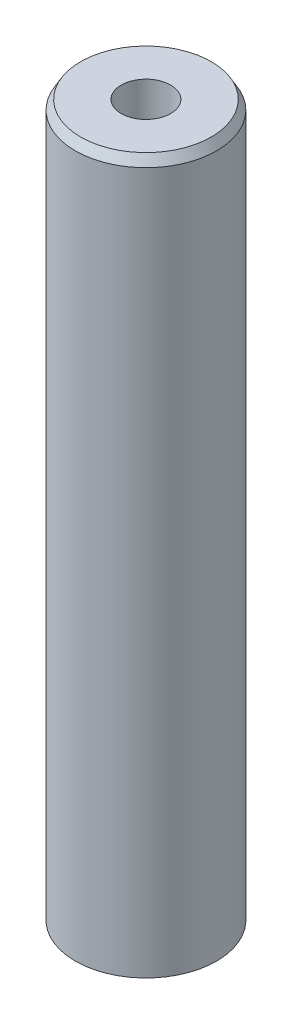
from build123d import *
from OCP.BRepFilletAPI import BRepFilletAPI_MakeChamfer

# Parameters (mm, degrees)
SKETCH1_R           = 27.5
BOSS_EXTRUDE1_DEPTH = 278.762209575
SKETCH2_R           = 9.622641247
CUT_EXTRUDE1_DEPTH  = 282.462021394
CHAMFER1_SIZE       = 3.614289991
CHAMFER1_SIZE2      = 2.086711299


with BuildPart() as part:
    # Sketch1 → Boss-Extrude1 (new body)
    with BuildSketch(Plane(origin=(0, 0, 0), x_dir=(1, 0, 0), z_dir=(0, 1, 0))):
        Circle(SKETCH1_R)
    extrude(amount=BOSS_EXTRUDE1_DEPTH)

    # Sketch2 → Cut-Extrude1 (cut, through all)
    with BuildSketch(Plane(origin=(0, 0, 0), x_dir=(1, 0, 0), z_dir=(0, 1, 0))):
        Circle(SKETCH2_R)
    extrude(amount=CUT_EXTRUDE1_DEPTH, mode=Mode.SUBTRACT)

    # Chamfer1: one chamfer whose edges measure the first distance from different faces: ONE call of the kernel's chamfer builder (chamfer() names one face for all edges)
    chamfer1_edges_1 = [part.edges().sort_by_distance(p)[0] for p in [
        (-27.5, 278.762209575, 0),
    ]]
    chamfer1_side_1 = [part.faces().sort_by_distance(p)[0] for p in [
        (-27.5, 139.381104788, 0),
    ]]
    chamfer1_edges_2 = [part.edges().sort_by_distance(p)[0] for p in [
        (-27.5, 0, 0),
    ]]
    chamfer1_side_2 = [part.faces().sort_by_distance(p)[0] for p in [
        (-26.722182541, 0, 0),
    ]]
    chamfer1 = BRepFilletAPI_MakeChamfer(part.part.solid().wrapped)
    for e in chamfer1_edges_1:
        chamfer1.Add(CHAMFER1_SIZE, CHAMFER1_SIZE2, e.wrapped, chamfer1_side_1[0].wrapped)  # the first distance lies on this face
    for e in chamfer1_edges_2:
        chamfer1.Add(CHAMFER1_SIZE, CHAMFER1_SIZE2, e.wrapped, chamfer1_side_2[0].wrapped)  # the first distance lies on this face
    add(Compound.cast(chamfer1.Shape()), mode=Mode.REPLACE)


solid = part.part
